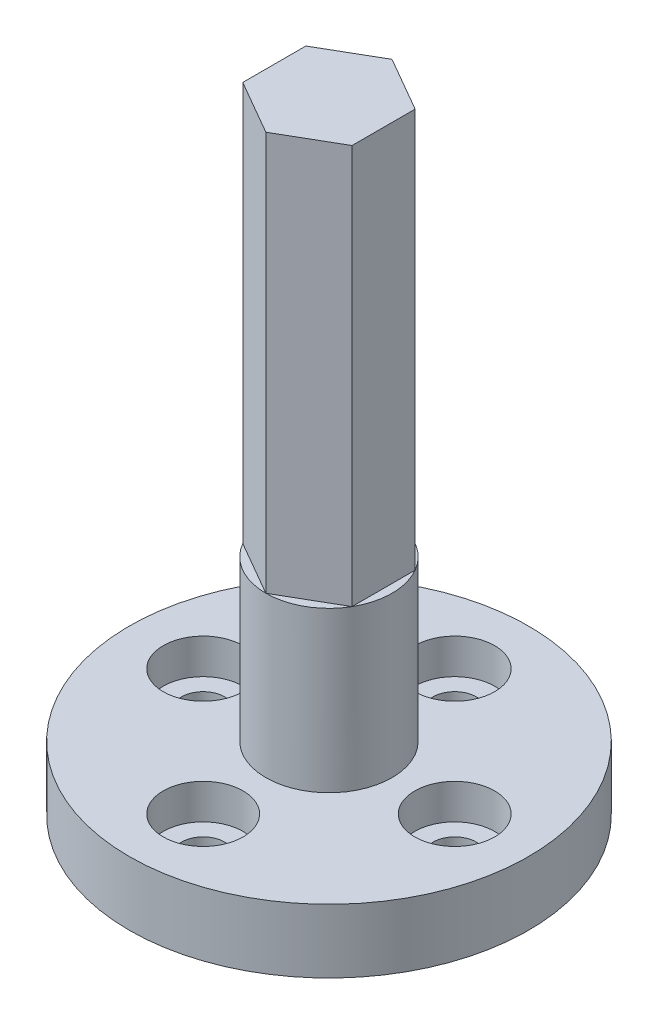
from build123d import *

# Parameters (mm, degrees)
CROQUIS3_R              = 12.5
SALIENTE_EXTRUIR1_DEPTH = 4
CROQUIS4_R              = 3.95
SALIENTE_EXTRUIR2_DEPTH = 35
CROQUIS12_OUTSIDE_W     = 37.528
CROQUIS12_OUTSIDE_H     = 37.528
CORTAR_EXTRUIR7_DEPTH   = 25
CROQUIS13_R             = 1.35
CORTAR_EXTRUIR8_DEPTH   = 10
CROQUIS14_R             = 2.5
CORTAR_EXTRUIR9_DEPTH   = 2.2


with BuildPart() as part:
    # Croquis3 → Saliente-Extruir1 (new body)
    with BuildSketch(Plane(origin=(0, 0, 0), x_dir=(1, 0, 0), z_dir=(0, 1, 0))):
        Circle(CROQUIS3_R)
    extrude(amount=SALIENTE_EXTRUIR1_DEPTH)

    # Croquis4 → Saliente-Extruir2 (add)
    with BuildSketch(Plane(origin=(0, 4, 0), x_dir=(1, 0, 0), z_dir=(0, 1, 0))):
        Circle(CROQUIS4_R)
    extrude(amount=SALIENTE_EXTRUIR2_DEPTH)

    # Croquis12 outside → Cortar-Extruir7 (cut)
    with BuildSketch(Plane(origin=(0, 39, 0), x_dir=(1, 0, 0), z_dir=(0, 1, 0))):
        Rectangle(CROQUIS12_OUTSIDE_W, CROQUIS12_OUTSIDE_H)
        Polygon((0, 3.95), (-3.420800345, 1.975), (-3.420800345, -1.975), (0, -3.95), (3.420800345, -1.975), (3.420800345, 1.975), align=None, mode=Mode.SUBTRACT)
    extrude(amount=-CORTAR_EXTRUIR7_DEPTH, mode=Mode.SUBTRACT)

    # Croquis13 → Cortar-Extruir8 (cut)
    with BuildSketch(Plane.XZ):
        with Locations((0, 7.875)):
            Circle(CROQUIS13_R)
        with Locations((7.875, 0)):
            Circle(CROQUIS13_R)
        with Locations((0, -7.875)):
            Circle(CROQUIS13_R)
        with Locations((-7.875, 0)):
            Circle(CROQUIS13_R)
    extrude(amount=-CORTAR_EXTRUIR8_DEPTH, mode=Mode.SUBTRACT)

    # Croquis14 → Cortar-Extruir9 (cut)
    with BuildSketch(Plane(origin=(0, 4, 0), x_dir=(1, 0, 0), z_dir=(0, 1, 0))):
        with Locations((0, 7.875)):
            Circle(CROQUIS14_R)
        with Locations((7.875, 0)):
            Circle(CROQUIS14_R)
        with Locations((0, -7.875)):
            Circle(CROQUIS14_R)
        with Locations((-7.875, 0)):
            Circle(CROQUIS14_R)
    extrude(amount=-CORTAR_EXTRUIR9_DEPTH, mode=Mode.SUBTRACT)


solid = part.part
